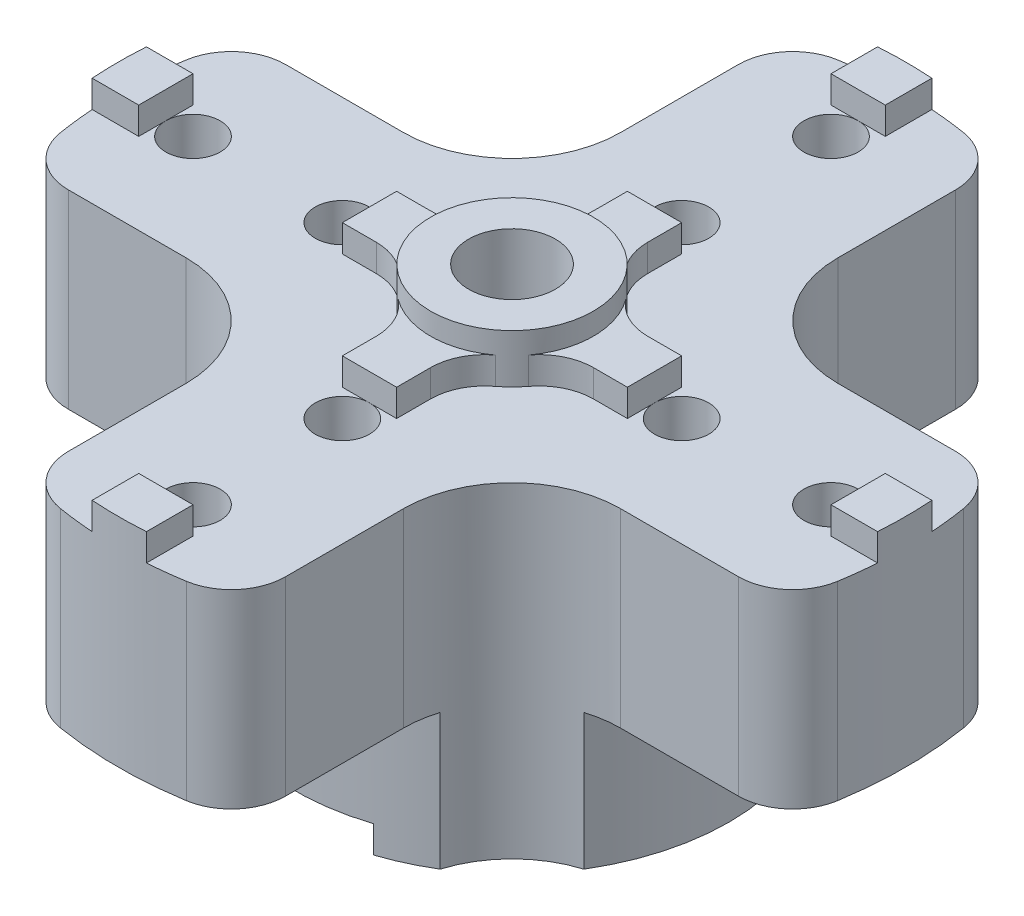
from build123d import *

# Parameters (mm, degrees)
BOSS_EXTRUDE1_DEPTH   = 3.5
BOSS_EXTRUDE2_DEPTH   = 0.5
SKETCH6_R             = 4
BOSS_EXTRUDE4_DEPTH   = 2
FILLET1_R             = 1
SKETCH13_R            = 1.5
BOSS_EXTRUDE7_DEPTH   = 0.9
M2X0_4_TAPPED_HOLE1_D = 1.6
BOSS_EXTRUDE5_DEPTH   = 0.5
CUT_EXTRUDE1_START    = -3
SKETCH5_R             = 0.5
CUT_EXTRUDE1_DEPTH    = 3
SKETCH10_W            = 1
SKETCH10_H            = 3.75
SKETCH10_W_2          = 3.75
SKETCH10_H_2          = 1
CUT_EXTRUDE2_DEPTH    = 0.5
CHAMFER1_SIZE         = 0.75
FILLET2_R             = 2
CUT_EXTRUDE3_REACH    = 13.157
FILLET3_R             = 1


with BuildPart() as part:
    # Sketch3 → Boss-Extrude1 (new body)
    with BuildSketch(Plane(origin=(0, 0, 0), x_dir=(1, 0, 0), z_dir=(0, 1, 0))):
        with BuildLine():
            Line((-2, -6.968679932), (-2, -2))
            Line((-2, -2), (-6.968679932, -2))
            ThreePointArc((-6.968679932, -2), (-7.179325508, -1.009844169), (-7.25, 0))
            ThreePointArc((-7.25, 0), (-7.179325508, 1.009844169), (-6.968679932, 2))
            Line((-6.968679932, 2), (-2, 2))
            Line((-2, 2), (-2, 6.968679932))
            ThreePointArc((-2, 6.968679932), (-1.009844169, 7.179325508), (0, 7.25))
            ThreePointArc((0, 7.25), (1.009844169, 7.179325508), (2, 6.968679932))
            Line((2, 6.968679932), (2, 2))
            Line((2, 2), (6.968679932, 2))
            ThreePointArc((6.968679932, 2), (7.179325508, 1.009844169), (7.25, 0))
            ThreePointArc((7.25, 0), (7.179325508, -1.009844169), (6.968679932, -2))
            Line((6.968679932, -2), (2, -2))
            Line((2, -2), (2, -6.968679932))
            ThreePointArc((2, -6.968679932), (1.009844169, -7.179325508), (0, -7.25))
            ThreePointArc((0, -7.25), (-1.009844169, -7.179325508), (-2, -6.968679932))
        make_face()
    extrude(amount=BOSS_EXTRUDE1_DEPTH)

    # Sketch4 → Boss-Extrude2 (add)
    with BuildSketch(Plane(origin=(0, 3.5, 0), x_dir=(-1, 0, 0), z_dir=(0, 1, 0))):
        with BuildLine():
            Line((-0.5, 5.875), (-0.5, 7.232738071))
            ThreePointArc((-0.5, 7.232738071), (0, 7.25), (0.5, 7.232738071))
            Line((0.5, 7.232738071), (0.5, 5.875))
            ThreePointArc((0.5, 5.875), (0, 5.375), (-0.5, 5.875))
        make_face()
        with BuildLine():
            Line((0.5, 3.125), (0.5, 0.5))
            Line((0.5, 0.5), (3.125, 0.5))
            ThreePointArc((3.125, 0.5), (3.625, 0), (3.125, -0.5))
            Line((3.125, -0.5), (0.5, -0.5))
            Line((0.5, -0.5), (0.5, -3.125))
            ThreePointArc((0.5, -3.125), (0, -3.625), (-0.5, -3.125))
            Line((-0.5, -3.125), (-0.5, -0.5))
            Line((-0.5, -0.5), (-3.125, -0.5))
            ThreePointArc((-3.125, -0.5), (-3.625, 0), (-3.125, 0.5))
            Line((-3.125, 0.5), (-0.5, 0.5))
            Line((-0.5, 0.5), (-0.5, 3.125))
            ThreePointArc((-0.5, 3.125), (0, 3.625), (0.5, 3.125))
        make_face()
        with BuildLine():
            Line((5.875, 0.5), (7.232738071, 0.5))
            ThreePointArc((7.232738071, 0.5), (7.25, 0), (7.232738071, -0.5))
            Line((7.232738071, -0.5), (5.875, -0.5))
            ThreePointArc((5.875, -0.5), (5.375, 0), (5.875, 0.5))
        make_face()
        with BuildLine():
            Line((0.5, -5.875), (0.5, -7.232738071))
            ThreePointArc((0.5, -7.232738071), (0, -7.25), (-0.5, -7.232738071))
            Line((-0.5, -7.232738071), (-0.5, -5.875))
            ThreePointArc((-0.5, -5.875), (0, -5.375), (0.5, -5.875))
        make_face()
        with BuildLine():
            Line((-5.875, -0.5), (-7.232738071, -0.5))
            ThreePointArc((-7.232738071, -0.5), (-7.25, 0), (-7.232738071, 0.5))
            Line((-7.232738071, 0.5), (-5.875, 0.5))
            ThreePointArc((-5.875, 0.5), (-5.375, 0), (-5.875, -0.5))
        make_face()
    extrude(amount=BOSS_EXTRUDE2_DEPTH)

    # Sketch6 → Boss-Extrude4 (add)
    with BuildSketch(Plane.XZ):
        with Locations(Location((0, 0, 0), (0, 0, 120))):
            Circle(SKETCH6_R)
    extrude(amount=BOSS_EXTRUDE4_DEPTH)

    # Fillet1
    fillet1_edges = [part.edges().sort_by_distance(p)[0] for p in [
        (-2, 1.75, 6.968679932),
        (-6.968679932, 1.75, 2),
        (-6.968679932, 1.75, -2),
        (-2, 1.75, -6.968679932),
        (2, 1.75, -6.968679932),
        (6.968679932, 1.75, -2),
        (6.968679932, 1.75, 2),
        (2, 1.75, 6.968679932),
    ]]
    fillet(fillet1_edges, radius=FILLET1_R)

    # Sketch13 → Boss-Extrude7 (add)
    with BuildSketch(Plane(origin=(0, 3.5, 0), x_dir=(1, 0, 0), z_dir=(0, 1, 0))):
        with Locations(Location((0, 0, 0), (0, 0, 109.471220634))):
            Circle(SKETCH13_R)
    extrude(amount=BOSS_EXTRUDE7_DEPTH)

    # M2x0.4 Tapped Hole1 (through all)
    with Locations(Plane(origin=(0, -2, 0), x_dir=(-1, 0, 0), z_dir=(0, -1, 0))):
        with Locations((0, 0)):
            Hole(M2X0_4_TAPPED_HOLE1_D / 2)

    # Sketch9 → Boss-Extrude5 (add)
    with BuildSketch(Plane.XZ.offset(2)):
        with BuildLine():
            Line((-1.25, -2.727178029), (-1.25, -3.799671038))
            ThreePointArc((-1.25, -3.799671038), (-4, 0), (-1.25, 3.799671038))
            Line((-1.25, 3.799671038), (-1.25, 2.727178029))
            ThreePointArc((-1.25, 2.727178029), (-3, 0), (-1.25, -2.727178029))
        make_face()
        with BuildLine():
            Line((1.25, 2.727178029), (1.25, 3.799671038))
            ThreePointArc((1.25, 3.799671038), (4, 0), (1.25, -3.799671038))
            Line((1.25, -3.799671038), (1.25, -2.727178029))
            ThreePointArc((1.25, -2.727178029), (3, 0), (1.25, 2.727178029))
        make_face()
    extrude(amount=BOSS_EXTRUDE5_DEPTH)

    # Sketch5 → Cut-Extrude1 (cut)
    with BuildSketch(Plane(origin=(0, 4, 0), x_dir=(-1, 0, 0), z_dir=(0, 1, 0)).offset(CUT_EXTRUDE1_START)):
        with Locations(Location((0, 5.875, 0), (0, 0, 90))):
            Circle(SKETCH5_R)
        with Locations(Location((0, 3.125, 0), (0, 0, 90))):
            Circle(SKETCH5_R)
        with Locations(Location((5.875, 0, 0), (0, 0, 90))):
            Circle(SKETCH5_R)
        with Locations(Location((3.125, 0, 0), (0, 0, 90))):
            Circle(SKETCH5_R)
        with Locations(Location((0, -5.875, 0), (0, 0, 90))):
            Circle(SKETCH5_R)
        with Locations(Location((0, -3.125, 0), (0, 0, 90))):
            Circle(SKETCH5_R)
        with Locations(Location((-5.875, 0, 0), (0, 0, 90))):
            Circle(SKETCH5_R)
        with Locations(Location((-3.125, 0, 0), (0, 0, 90))):
            Circle(SKETCH5_R)
    extrude(amount=CUT_EXTRUDE1_DEPTH, mode=Mode.SUBTRACT)

    # Sketch10 → Cut-Extrude2 (cut)
    with BuildSketch(Plane(origin=(0, 4, 0), x_dir=(1, 0, 0), z_dir=(0, 1, 0))):
        with Locations((0, -4.5)):
            Rectangle(SKETCH10_W, SKETCH10_H)
        with Locations((-4.5, 0)):
            Rectangle(SKETCH10_W_2, SKETCH10_H_2)
        with Locations((0, 4.5)):
            Rectangle(SKETCH10_W, SKETCH10_H)
        with Locations((4.5, 0)):
            Rectangle(SKETCH10_W_2, SKETCH10_H_2)
    extrude(amount=-CUT_EXTRUDE2_DEPTH, mode=Mode.SUBTRACT)

    # Chamfer1
    chamfer1_edges = [part.edges().sort_by_distance(p)[0] for p in [
        (-0.8, -2, 0),
    ]]
    chamfer(chamfer1_edges, length=CHAMFER1_SIZE)

    # Fillet2
    # the kernel refuses this fillet: 2 mm, written as the material it adds along each edge
    with BuildSketch(Plane(origin=(-2, 0, 2), x_dir=(0, 0, 1), z_dir=(0, 1, 0)), Plane(origin=(-2, 0, -2), x_dir=(-1, 0, 0), z_dir=(0, 1, 0)), Plane(origin=(2, 0, -2), x_dir=(0, 0, -1), z_dir=(0, 1, 0)), Plane(origin=(2, 0, 2), x_dir=(1, 0, 0), z_dir=(0, 1, 0))) as fillet2_piece_1:
        with BuildLine():
            CenterArc((FILLET2_R, -FILLET2_R), FILLET2_R, 90, 90)
            Line((0, -FILLET2_R), (0, 0))
            Line((0, 0), (FILLET2_R, 0))
        make_face()
    extrude(amount=3.5)

    # Sketch11 → Cut-Extrude3 (cut, up to next)
    with BuildSketch(Plane(origin=(0, 0, 0), x_dir=(1, 0, 0), z_dir=(0, 1, 0)), mode=Mode.PRIVATE) as cut_extrude3_sk1:
        with BuildLine():
            ThreePointArc((3.411437828, -2.088562172), (2.585786438, -2.585786438), (2.088562172, -3.411437828))
            ThreePointArc((2.088562172, -3.411437828), (2.828427125, -2.828427125), (3.411437828, -2.088562172))
        make_face()
    cut_extrude3_tool1 = extrude(cut_extrude3_sk1.sketch, amount=-CUT_EXTRUDE3_REACH, mode=Mode.PRIVATE) & part.part
    # Sketch11 → Cut-Extrude3 (cut, up to next)
    with BuildSketch(Plane(origin=(0, 0, 0), x_dir=(1, 0, 0), z_dir=(0, 1, 0)), mode=Mode.PRIVATE) as cut_extrude3_sk2:
        with BuildLine():
            ThreePointArc((2.088562172, 3.411437828), (2.585786438, 2.585786438), (3.411437828, 2.088562172))
            ThreePointArc((3.411437828, 2.088562172), (2.828427125, 2.828427125), (2.088562172, 3.411437828))
        make_face()
    cut_extrude3_tool2 = extrude(cut_extrude3_sk2.sketch, amount=-CUT_EXTRUDE3_REACH, mode=Mode.PRIVATE) & part.part
    # Sketch11 → Cut-Extrude3 (cut, up to next)
    with BuildSketch(Plane(origin=(0, 0, 0), x_dir=(1, 0, 0), z_dir=(0, 1, 0)), mode=Mode.PRIVATE) as cut_extrude3_sk3:
        with BuildLine():
            ThreePointArc((-3.411437828, 2.088562172), (-2.585786438, 2.585786438), (-2.088562172, 3.411437828))
            ThreePointArc((-2.088562172, 3.411437828), (-2.828427125, 2.828427125), (-3.411437828, 2.088562172))
        make_face()
    cut_extrude3_tool3 = extrude(cut_extrude3_sk3.sketch, amount=-CUT_EXTRUDE3_REACH, mode=Mode.PRIVATE) & part.part
    # Sketch11 → Cut-Extrude3 (cut, up to next)
    with BuildSketch(Plane(origin=(0, 0, 0), x_dir=(1, 0, 0), z_dir=(0, 1, 0)), mode=Mode.PRIVATE) as cut_extrude3_sk4:
        with BuildLine():
            ThreePointArc((-2.088562172, -3.411437828), (-2.585786438, -2.585786438), (-3.411437828, -2.088562172))
            ThreePointArc((-3.411437828, -2.088562172), (-2.828427125, -2.828427125), (-2.088562172, -3.411437828))
        make_face()
    cut_extrude3_tool4 = extrude(cut_extrude3_sk4.sketch, amount=-CUT_EXTRUDE3_REACH, mode=Mode.PRIVATE) & part.part
    add(cut_extrude3_tool1.solids().sort_by_distance((2.71527, 0, 2.71527))[0], mode=Mode.SUBTRACT)
    add(cut_extrude3_tool2.solids().sort_by_distance((2.71527, 0, -2.71527))[0], mode=Mode.SUBTRACT)
    add(cut_extrude3_tool3.solids().sort_by_distance((-2.71527, 0, -2.71527))[0], mode=Mode.SUBTRACT)
    add(cut_extrude3_tool4.solids().sort_by_distance((-2.71527, 0, 2.71527))[0], mode=Mode.SUBTRACT)

    # Fillet3
    # the kernel refuses this fillet: 1 mm, written as the material it adds along each edge
    with BuildSketch(Plane(origin=(-1.414213562, 4, -0.5), x_dir=(0.4720978535930623, 0, -0.8815461511644318), z_dir=(0, -1, 0)), Plane(origin=(-0.5, 4, 1.414213562), x_dir=(-0.8815461511644338, 0, -0.47209785359305884), z_dir=(0, -1, 0)), Plane(origin=(1.414213562, 4, 0.5), x_dir=(-0.47209785359305845, 0, 0.881546151164434), z_dir=(0, -1, 0)), Plane(origin=(0.5, 4, -1.414213562), x_dir=(0.8815461511644322, 0, 0.4720978535930617), z_dir=(0, -1, 0)), Plane(origin=(-0.5, 2.035533906, -1.414213562), x_dir=(-0.8815461511644342, 0, 0.47209785359305795), z_dir=(0, 1, 0))) as fillet3_piece_1:
        with BuildLine():
            CenterArc((0.604997631, -0.988495633), FILLET3_R, 98.699338506, 53.130102354)
            Line((-0.27654852, -0.516397779), (0, 0))
            ThreePointArc((0, 0), (0.226874112, -0.01725655), (0.453748223, 0))
        make_face()
    extrude(amount=1.964466094)
    with BuildSketch(Plane(origin=(-1.414213562, 4, 0.5), x_dir=(0.472097853593057, 0, 0.8815461511644348), z_dir=(0, -1, 0)), Plane(origin=(0.5, 4, 1.414213562), x_dir=(0.8815461511644329, 0, -0.47209785359306067), z_dir=(0, -1, 0))) as fillet3_piece_2:
        with BuildLine():
            CenterArc((0.604997631, 0.988495633), FILLET3_R, 208.17055914, 53.130102354)
            Line((-0.27654852, 0.516397779), (0, 0))
            ThreePointArc((0, 0), (0.226874112, 0.01725655), (0.453748223, 0))
        make_face()
    extrude(amount=1.964466094)
    with BuildSketch(Plane(origin=(1.414213562, 4, -0.5), x_dir=(1, 0, 0), z_dir=(0, -1, 0))) as fillet3_piece_3:
        with BuildLine():
            CenterArc((0.585786438, -1), FILLET3_R, 90, 53.130102354)
            ThreePointArc((-0.214213562, -0.4), (-0.091894336, -0.20814678), (0, 0))
            Line((0, 0), (0.585786438, 0))
        make_face()
    extrude(amount=1.964466094)


solid = part.part
